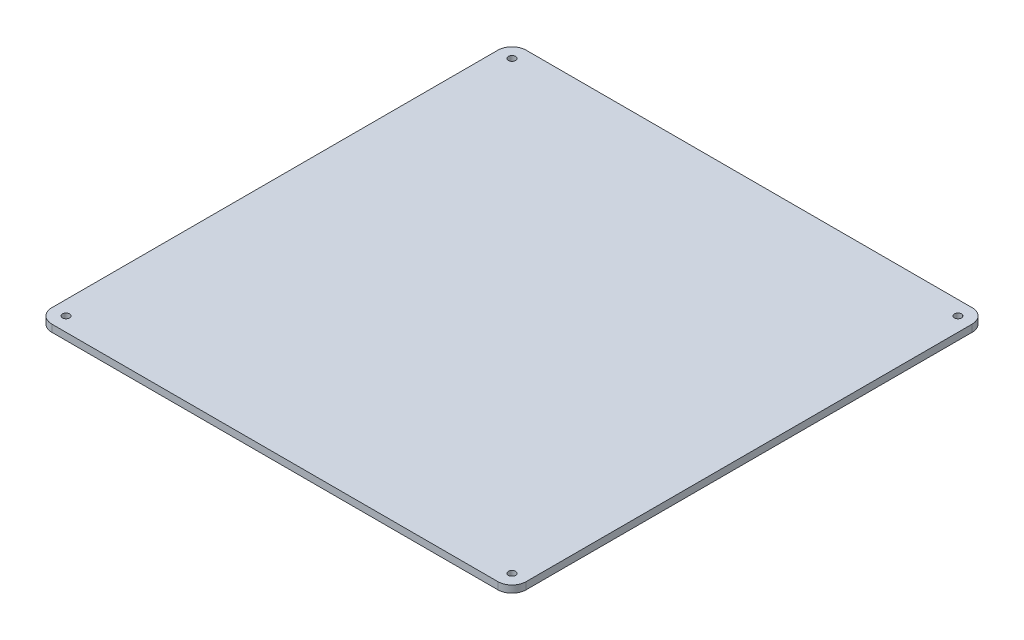
from build123d import *

# Parameters (mm, degrees)
SKETCH1_W           = 200
SKETCH1_H           = 200
BOSS_EXTRUDE1_DEPTH = 3
FILLET1_R           = 6
FILLET2_R           = 6
FILLET3_R           = 6
FILLET4_R           = 6
SKETCH2_R           = 1.5
CUT_EXTRUDE1_DEPTH  = 283.85862193


with BuildPart() as part:
    # Sketch1 → Boss-Extrude1 (new body)
    with BuildSketch(Plane(origin=(0, 0, 0), x_dir=(1, 0, 0), z_dir=(0, 1, 0))):
        with Locations((100, 100)):
            Rectangle(SKETCH1_W, SKETCH1_H)
    extrude(amount=BOSS_EXTRUDE1_DEPTH)

    # Fillet1
    fillet1_edges = [part.edges().sort_by_distance(p)[0] for p in [
        (0, 1.5, -200),
    ]]
    fillet(fillet1_edges, radius=FILLET1_R)

    # Fillet2
    fillet2_edges = [part.edges().sort_by_distance(p)[0] for p in [
        (200, 1.5, -200),
    ]]
    fillet(fillet2_edges, radius=FILLET2_R)

    # Fillet3
    fillet3_edges = [part.edges().sort_by_distance(p)[0] for p in [
        (200, 1.5, 0),
    ]]
    fillet(fillet3_edges, radius=FILLET3_R)

    # Fillet4
    fillet4_edges = [part.edges().sort_by_distance(p)[0] for p in [
        (0, 1.5, 0),
    ]]
    fillet(fillet4_edges, radius=FILLET4_R)

    # Sketch2 → Cut-Extrude1 (cut, through all)
    with BuildSketch(Plane(origin=(0, 3, 0), x_dir=(1, 0, 0), z_dir=(0, 1, 0))):
        with Locations((6, 194)):
            Circle(SKETCH2_R)
        with Locations((194, 194)):
            Circle(SKETCH2_R)
        with Locations((6, 6)):
            Circle(SKETCH2_R)
        with Locations((194, 6)):
            Circle(SKETCH2_R)
    extrude(amount=-CUT_EXTRUDE1_DEPTH, mode=Mode.SUBTRACT)


solid = part.part
